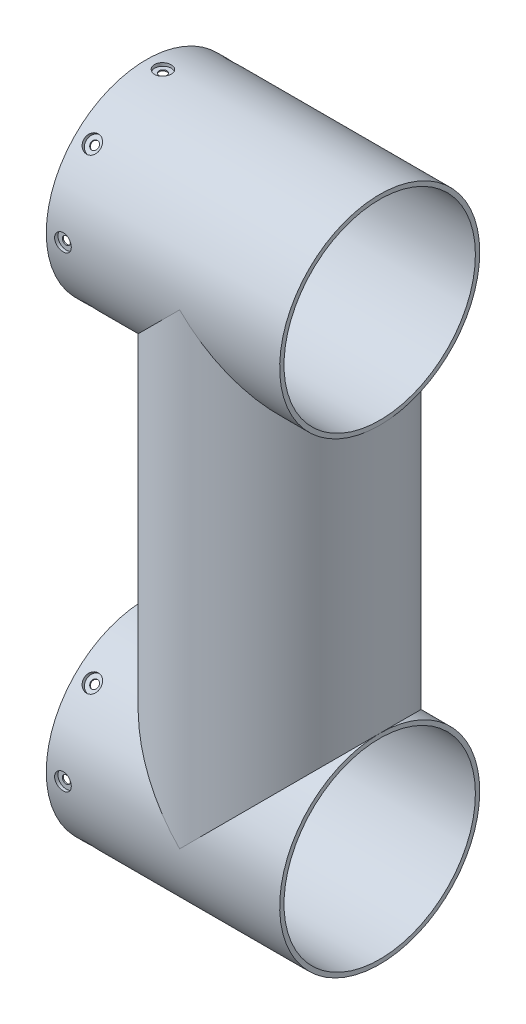
from build123d import *
from build123d.topology import SkipClean

# Parameters (mm, degrees)
SKETCH_1_R               = 30
EXTRUDE_1_DEPTH          = 140
EXTRUDE_START            = -40
SKETCH_2_R               = 30
EXTRUDE_2_DEPTH          = 70
SKETCH_3_R               = 28.7
CUT_EXTRUDE_1_DEPTH      = 160.373774505
SKETCH_4_R               = 28.7
CUT_EXTRUDE_2_DEPTH      = 140
PATTERN_CIRCULAR_1_COUNT = 8


with BuildPart() as part:
    # 스케치1 → 보스-돌출1 (new body)
    with BuildSketch(Plane(origin=(0, 0, 0), x_dir=(1, 0, 0), z_dir=(0, 1, 0))):
        Circle(SKETCH_1_R)
    extrude(amount=EXTRUDE_1_DEPTH)

    # 스케치2 → 보스-돌출2 (add)
    with SkipClean():  # the faces are left unmerged after this step: merging them gives an invalid solid
        with BuildSketch(Plane(origin=(0, 0, 0), x_dir=(0, 0, -1), z_dir=(1, 0, 0)).offset(EXTRUDE_START)):
            Circle(SKETCH_2_R)
        extrude_2 = extrude(amount=EXTRUDE_2_DEPTH)
    add(part.part.scale(1), mode=Mode.REPLACE)  # the faces are merged on a copy

    # 스케치3 → 컷-돌출1 (cut, through all)
    with BuildSketch(Plane(origin=(30, 0, 0), x_dir=(0, 0, -1), z_dir=(1, 0, 0))):
        Circle(SKETCH_3_R)
    cut_extrude_1 = extrude(amount=-CUT_EXTRUDE_1_DEPTH, mode=Mode.SUBTRACT)

    # 스케치4 → 컷-돌출2 (cut)
    with BuildSketch(Plane(origin=(0, 140, 0), x_dir=(1, 0, 0), z_dir=(0, 1, 0))):
        Circle(SKETCH_4_R)
    extrude(amount=-CUT_EXTRUDE_2_DEPTH, mode=Mode.SUBTRACT)

    # 스케치7 → M2 남비 머리 나사용 카운터보어1 (revolve, cut)
    with BuildSketch(Plane(origin=(-35, 0, 30), x_dir=(0, -1, 0), z_dir=(1, 0, 0))):
        Polygon((0, 0), (0, 10.721032743), (1.2, 10), (1.2, 1), (2.5, 1), (2.5, 0), align=None)
    hole_wizard_m2_1 = revolve(axis=Axis((-35, 0, 36.35), (0, 0, -1)), mode=Mode.SUBTRACT)

    # 원형 패턴1: M2 남비 머리 나사용 카운터보어1 ×8 about axis
    pattern_circular_1_axis = Axis((-40, 0, 0), (1, 0, 0))
    for i in range(1, PATTERN_CIRCULAR_1_COUNT):
        add(hole_wizard_m2_1.rotate(pattern_circular_1_axis, i * 360 / PATTERN_CIRCULAR_1_COUNT), mode=Mode.SUBTRACT)

    # 대칭 복사2: 보스-돌출2, 컷-돌출1, M2 남비 머리 나사용 카운터보어1 across plane
    with SkipClean():  # the faces are left unmerged after this step: merging them gives an invalid solid
        add(extrude_2.mirror(Plane.ZX.offset(70)))
        add(cut_extrude_1.mirror(Plane.ZX.offset(70)), mode=Mode.SUBTRACT)
        add(hole_wizard_m2_1.mirror(Plane.ZX.offset(70)), mode=Mode.SUBTRACT)

    # 대칭 복사2 copy 1 sketch → 대칭 복사2 copy 1 (revolve, cut)
    with BuildSketch(Plane(origin=(-35, 161.213203436, 21.213203436), x_dir=(0, 0.7071067811865476, -0.7071067811865475), z_dir=(1, 0, 0))):
        Polygon((0, 0), (0, -10.721032743), (1.2, -10), (1.2, -1), (2.5, -1), (2.5, 0), align=None)
    revolve(axis=Axis((-35, 165.703331496, 25.703331496), (0, 0.7071067811865475, 0.7071067811865476)), mode=Mode.SUBTRACT)

    # 대칭 복사2 copy 2 sketch → 대칭 복사2 copy 2 (revolve, cut)
    with BuildSketch(Plane(origin=(-35, 170, 0), x_dir=(0, 0, -1), z_dir=(1, 0, 0))):
        Polygon((0, 0), (0, -10.721032743), (1.2, -10), (1.2, -1), (2.5, -1), (2.5, 0), align=None)
    revolve(axis=Axis((-35, 176.35, 0), (0, 1, 0)), mode=Mode.SUBTRACT)

    # 대칭 복사2 copy 3 sketch → 대칭 복사2 copy 3 (revolve, cut)
    with BuildSketch(Plane(origin=(-35, 161.213203436, -21.213203436), x_dir=(0, -0.7071067811865475, -0.7071067811865476), z_dir=(1, 0, 0))):
        Polygon((0, 0), (0, -10.721032743), (1.2, -10), (1.2, -1), (2.5, -1), (2.5, 0), align=None)
    revolve(axis=Axis((-35, 165.703331496, -25.703331496), (0, 0.7071067811865476, -0.7071067811865475)), mode=Mode.SUBTRACT)

    # 대칭 복사2 copy 4 sketch → 대칭 복사2 copy 4 (revolve, cut)
    with SkipClean():  # the faces are left unmerged after this step: merging them gives an invalid solid
        with BuildSketch(Plane(origin=(-35, 140, -30), x_dir=(0, -1, 0), z_dir=(1, 0, 0))):
            Polygon((0, 0), (0, -10.721032743), (1.2, -10), (1.2, -1), (2.5, -1), (2.5, 0), align=None)
        revolve(axis=Axis((-35, 140, -36.35), (0, 0, -1)), mode=Mode.SUBTRACT)

    # 대칭 복사2 copy 5 sketch → 대칭 복사2 copy 5 (revolve, cut)
    with BuildSketch(Plane(origin=(-35, 118.786796564, -21.213203436), x_dir=(0, -0.7071067811865477, 0.7071067811865475), z_dir=(1, 0, 0))):
        Polygon((0, 0), (0, -10.721032743), (1.2, -10), (1.2, -1), (2.5, -1), (2.5, 0), align=None)
    revolve(axis=Axis((-35, 114.296668504, -25.703331496), (0, -0.7071067811865475, -0.7071067811865477)), mode=Mode.SUBTRACT)

    # 대칭 복사2 copy 6 sketch → 대칭 복사2 copy 6 (revolve, cut)
    with BuildSketch(Plane(origin=(-35, 110, 0), x_dir=(0, 0, 1), z_dir=(1, 0, 0))):
        Polygon((0, 0), (0, -10.721032743), (1.2, -10), (1.2, -1), (2.5, -1), (2.5, 0), align=None)
    revolve(axis=Axis((-35, 103.65, 0), (0, -1, 0)), mode=Mode.SUBTRACT)

    # 대칭 복사2 copy 7 sketch → 대칭 복사2 copy 7 (revolve, cut)
    with BuildSketch(Plane(origin=(-35, 118.786796564, 21.213203436), x_dir=(0, 0.7071067811865474, 0.7071067811865477), z_dir=(1, 0, 0))):
        Polygon((0, 0), (0, -10.721032743), (1.2, -10), (1.2, -1), (2.5, -1), (2.5, 0), align=None)
    revolve(axis=Axis((-35, 114.296668504, 25.703331496), (0, -0.7071067811865477, 0.7071067811865474)), mode=Mode.SUBTRACT)


solid = part.part
